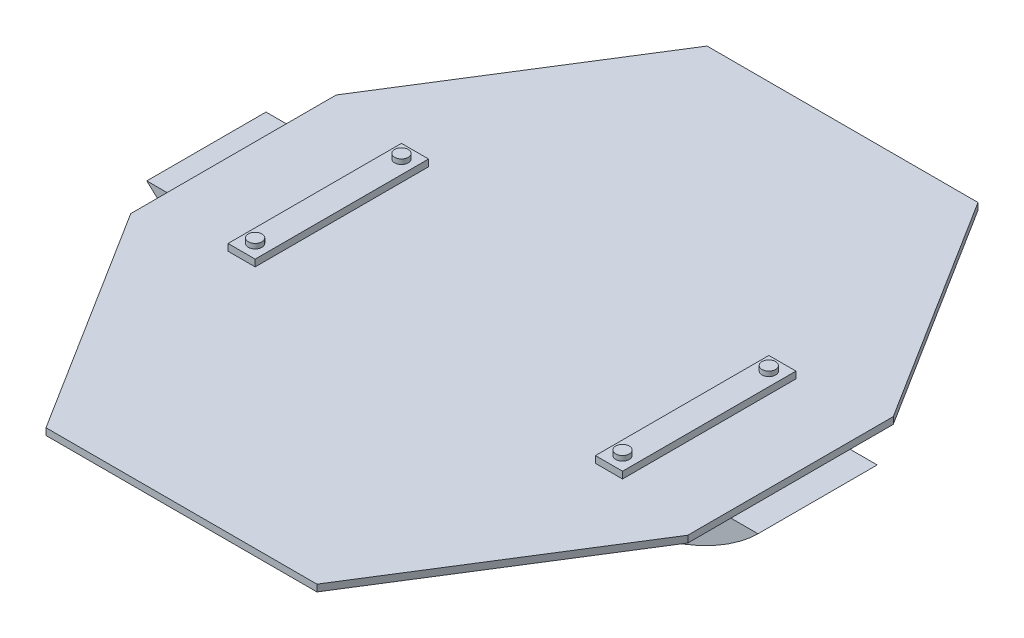
from build123d import *

# Parameters (mm, degrees)
BOSS_EXTRUDE1_DEPTH                 = 111.76
SKETCH5_W                           = 304.8
SKETCH5_H                           = 25.4
CUT_EXTRUDE3_DEPTH                  = 101.6
CUT_EXTRUDE4_DEPTH                  = 227.288199427
CUT_EXTRUDE4_DEPTH_BACK             = 227.288199427
SKETCH3_W                           = 96.52
SKETCH3_H                           = 101.6
SKETCH3_W_2                         = 48.26
CUT_EXTRUDE5_REACH                  = 288.663
SKETCH6_W                           = 38.1
SKETCH6_H                           = 50.8
SKETCH7_W                           = 81.28
SKETCH7_H                           = 50.8
BOSS_EXTRUDE2_DEPTH                 = 5.08
SKETCH9_W                           = 5.08
SKETCH9_H                           = 95.25
BOSS_EXTRUDE3_DEPTH                 = 10.16
SKETCH10_W                          = 5.08
SKETCH10_H                          = 95.206439839
BOSS_EXTRUDE4_DEPTH                 = 10.16
CUT_EXTRUDE7_REACH                  = 208.854
FILLET1_R                           = 50.8
BOSS_EXTRUDE5_REACH                 = 208.854
CUT_EXTRUDE8_REACH                  = 248.593
CUT_EXTRUDE8_END_RADIUS             = 126.32098656
CUT_EXTRUDE8_DIRECTION_2_REACH      = 248.593
CUT_EXTRUDE8_DIRECTION_2_END_RADIUS = 126.32098656
BOSS_EXTRUDE6_REACH                 = 248.593
CUT_EXTRUDE9_DEPTH                  = 241.3
CUT_EXTRUDE9_DEPTH_BACK             = 241.3
CUT_EXTRUDE10_REACH                 = 346.185
SKETCH16_W                          = 38.1
SKETCH16_H                          = 50.8
CUT_EXTRUDE10_DIRECTION_2_REACH     = 346.185
CUT_EXTRUDE11_START                 = -319.532
SKETCH17_W                          = 111.76
SKETCH17_H                          = 50.800000001
CUT_EXTRUDE11_DEPTH                 = 639.064
BOSS_EXTRUDE7_DEPTH                 = 254
BOSS_EXTRUDE7_DEPTH_BACK            = 365.76
SKETCH19_W                          = 573.01922816
SKETCH19_H                          = 6.35
CUT_EXTRUDE12_DEPTH                 = 6.35
CUT_EXTRUDE13_REACH                 = 470.643
SKETCH21_W                          = 25.392722083
SKETCH21_H                          = 6.35
CUT_EXTRUDE13_DIRECTION_2_REACH     = 470.643
SKETCH22_W                          = 25.4
SKETCH22_H                          = 6.35
BOSS_EXTRUDE8_DEPTH                 = 25.4
SKETCH23_W                          = 25.4
SKETCH23_H                          = 162.56
BOSS_EXTRUDE9_DEPTH                 = 12.7
BOSS_EXTRUDE10_DEPTH                = 5.08
BOSS_EXTRUDE10_DEPTH_BACK           = 63.5
SKETCH24_R                          = 6.393052053


with BuildPart() as part:
    # Sketch1 → Boss-Extrude1 (new body)
    with BuildSketch(Plane.XY):
        Polygon((-152.4, 62.23), (-152.4, -33.02), (0, -62.23), (152.4, -32.976439839), (152.4, 62.23), align=None)
    extrude(amount=-BOSS_EXTRUDE1_DEPTH)

    # Sketch5 → Cut-Extrude3 (cut)
    with BuildSketch(Plane.XY.offset(-5.08)):
        with Locations((0, -1.27)):
            Rectangle(SKETCH5_W, SKETCH5_H)
    extrude(amount=-CUT_EXTRUDE3_DEPTH, mode=Mode.SUBTRACT)

    # Sketch3 → Cut-Extrude4 (cut, two sides: drawn at the far end of the back side and taken through both)
    with BuildSketch(Plane(origin=(0, 62.23, 0), x_dir=(1, 0, 0), z_dir=(0, 1, 0)).offset(-CUT_EXTRUDE4_DEPTH_BACK)):
        with Locations((-50.8, 55.88)):
            Rectangle(SKETCH3_W, SKETCH3_H)
        with Locations((50.8, 55.88)):
            Rectangle(SKETCH3_W, SKETCH3_H)
        with Locations((-128.27, 55.88)):
            Rectangle(SKETCH3_W_2, SKETCH3_H)
        with Locations((128.27, 55.88)):
            Rectangle(SKETCH3_W_2, SKETCH3_H)
    extrude(amount=CUT_EXTRUDE4_DEPTH + CUT_EXTRUDE4_DEPTH_BACK, mode=Mode.SUBTRACT)

    # Cut-Extrude5: up to this face of the body (flat: up to its plane)
    cut_extrude5_end = Plane(part.part.faces().sort_by_distance((104.14, 36.83, -55.88))[0])
    # Sketch6 → Cut-Extrude5 (cut, up to the picked face)
    with BuildSketch(Plane.ZY.offset(104.14), mode=Mode.PRIVATE) as cut_extrude5_sk1:
        with Locations((-55.932057734, 36.83)):
            Rectangle(SKETCH6_W, SKETCH6_H)
    cut_extrude5_tool1 = split(extrude(cut_extrude5_sk1.sketch, amount=-CUT_EXTRUDE5_REACH, mode=Mode.PRIVATE), bisect_by=cut_extrude5_end, keep=Keep.BOTH, mode=Mode.PRIVATE)
    add(cut_extrude5_tool1.solids().sort_by(Axis((-104.14, 36.83, -55.932058), (1, 0, 0)))[0], mode=Mode.SUBTRACT)

    # Sketch7 → Boss-Extrude2 (add)
    with BuildSketch(Plane(origin=(0, 0, -36.882057734), x_dir=(-1, 0, 0), z_dir=(0, 0, -1))):
        with Locations((0, 36.83)):
            Rectangle(SKETCH7_W, SKETCH7_H)
        with Locations((101.6, 36.83)):
            Rectangle(SKETCH7_W, SKETCH7_H)
        with Locations((-101.6, 36.83)):
            Rectangle(SKETCH7_W, SKETCH7_H)
    boss_extrude2 = extrude(amount=-BOSS_EXTRUDE2_DEPTH)

    # Mirror1: Boss-Extrude2 across plane
    add(boss_extrude2.mirror(Plane(origin=(0, 0, -55.932057734), x_dir=(1, 0, 0), z_dir=(0, 0, -1))))

    # Sketch9 → Boss-Extrude3 (add)
    with BuildSketch(Plane.ZY.offset(152.4)):
        with Locations((-109.22, 14.605)):
            Rectangle(SKETCH9_W, SKETCH9_H)
        with Locations((-2.54, 14.605)):
            Rectangle(SKETCH9_W, SKETCH9_H)
    extrude(amount=BOSS_EXTRUDE3_DEPTH)

    # Sketch10 → Boss-Extrude4 (add)
    with BuildSketch(Plane(origin=(152.4, 0, 0), x_dir=(0, 0, -1), z_dir=(1, 0, 0))):
        with Locations((2.54, 14.626780081)):
            Rectangle(SKETCH10_W, SKETCH10_H)
        with Locations((109.22, 14.626780081)):
            Rectangle(SKETCH10_W, SKETCH10_H)
    extrude(amount=BOSS_EXTRUDE4_DEPTH)

    # Cut-Extrude7: up to this face of the body (flat: up to its plane)
    cut_extrude7_end = Plane(part.part.faces().sort_by_distance((-0.011490312, 7.400814094, -111.76))[0])
    # Sketch11 → Cut-Extrude7 (cut, up to the picked face)
    with BuildSketch(Plane.XY, mode=Mode.PRIVATE) as cut_extrude7_sk1:
        Polygon((-162.56, -12.7), (-119.696308585, -39.288207521), (-152.4, -33.02), (-162.56, -33.02), align=None)
    cut_extrude7_tool1 = split(extrude(cut_extrude7_sk1.sketch, amount=-CUT_EXTRUDE7_REACH, mode=Mode.PRIVATE), bisect_by=cut_extrude7_end, keep=Keep.BOTH, mode=Mode.PRIVATE)
    # Sketch11 → Cut-Extrude7 (cut, up to the picked face)
    with BuildSketch(Plane.XY, mode=Mode.PRIVATE) as cut_extrude7_sk2:
        Polygon((152.4, -33.02), (162.56, -33.02), (162.56, -12.7), (119.696308585, -39.288207521), align=None)
    cut_extrude7_tool2 = split(extrude(cut_extrude7_sk2.sketch, amount=-CUT_EXTRUDE7_REACH, mode=Mode.PRIVATE), bisect_by=cut_extrude7_end, keep=Keep.BOTH, mode=Mode.PRIVATE)
    add(cut_extrude7_tool1.solids().sort_by(Axis((-148.539263, -27.801749, 0), (0, 0, -1)))[0], mode=Mode.SUBTRACT)
    add(cut_extrude7_tool2.solids().sort_by(Axis((148.539263, -27.801749, 0), (0, 0, -1)))[0], mode=Mode.SUBTRACT)

    # Fillet1
    # the kernel refuses this fillet: 50.8 mm, written as the material it takes off along each edge
    with BuildSketch(Plane(origin=(-162.56, -12.7, 70.671047804), x_dir=(0.8497897447130388, -0.5271217978613181, 0), z_dir=(0, 0, -1)), Plane(origin=(-162.56, -12.7, -36.008952196), x_dir=(0.8497897447130388, -0.5271217978613181, 0), z_dir=(0, 0, -1)), Plane(origin=(162.56, -12.7, 70.671047804), x_dir=(0, 1, 0), z_dir=(0, 0, -1))) as fillet1_piece_1:
        with BuildLine():
            CenterArc((FILLET1_R * 0.556464943335, -FILLET1_R), FILLET1_R, 90, 58.188808221)
            Line((-FILLET1_R * 0.293324801378, -FILLET1_R * 0.472878202139), (0, 0))
            Line((0, 0), (FILLET1_R * 0.556464943335, 0))
        make_face()
    extrude(amount=146.422095607, mode=Mode.SUBTRACT)
    with BuildSketch(Plane(origin=(-119.696308585, -39.288207521, -83.186546401), x_dir=(0.9821230119270369, -0.18824024395268216, 0), z_dir=(0, 0, -1)), Plane(origin=(-119.696308585, -39.288207521, 23.493453599), x_dir=(0.9821230119270369, -0.18824024395268216, 0), z_dir=(0, 0, -1))) as fillet1_piece_2:
        with BuildLine():
            CenterArc((FILLET1_R * 0.184987823618, -FILLET1_R), FILLET1_R, 90, 20.961087149)
            Line((-FILLET1_R * 0.172745995297, -FILLET1_R * 0.0661764005955), (0, 0))
            Line((0, 0), (FILLET1_R * 0.184987823618, 0))
        make_face()
    extrude(amount=52.066907199, mode=Mode.SUBTRACT)
    with BuildSketch(Plane(origin=(162.56, -12.7, -36.008952196), x_dir=(-0.8497897447130388, -0.5271217978613181, 0), z_dir=(0, 0, -1))) as fillet1_piece_3:
        with BuildLine():
            CenterArc((FILLET1_R * 0.556464943335, FILLET1_R), FILLET1_R, 211.811191779, 58.188808221)
            Line((-FILLET1_R * 0.293324801378, FILLET1_R * 0.472878202139), (0, 0))
            Line((0, 0), (FILLET1_R * 0.556464943335, 0))
        make_face()
    extrude(amount=146.422095607, mode=Mode.SUBTRACT)
    with BuildSketch(Plane(origin=(119.776180176, -39.238663434, 23.475348992), x_dir=(-0.9820710795721669, -0.18851099349363817, 0), z_dir=(0, 0, -1)), Plane(origin=(119.776180176, -39.238663434, -83.204651008), x_dir=(-0.9820710795721669, -0.18851099349363817, 0), z_dir=(0, 0, -1))) as fillet1_piece_4:
        with BuildLine():
            CenterArc((FILLET1_R * 0.184845267653, FILLET1_R), FILLET1_R, 249.054708445, 20.945291555)
            Line((-FILLET1_R * 0.172631096402, FILLET1_R * 0.0660778141933), (0, 0))
            Line((0, 0), (FILLET1_R * 0.184845267653, 0))
        make_face()
    extrude(amount=52.030697984, mode=Mode.SUBTRACT)
    with BuildSketch(Plane(origin=(0, -62.23, 24.359816254), x_dir=(-0.982123011927037, 0.1882402439526816, 0), z_dir=(0, 0, -1))) as fillet1_piece_5:
        with BuildLine():
            CenterArc((FILLET1_R * 0.191809576801, FILLET1_R), FILLET1_R, 248.283995147, 21.716004853)
            Line((-FILLET1_R * 0.178196707507, FILLET1_R * 0.0709707488072), (0, 0))
            Line((0, 0), (FILLET1_R * 0.191809576801, 0))
        make_face()
    extrude(amount=160.479632508, mode=Mode.SUBTRACT)

    # Boss-Extrude5: up to this face of the body (flat: up to its plane)
    boss_extrude5_end = Plane(part.part.faces().sort_by_distance((-0.004732582, 8.379000895, -111.76))[0])
    # Sketch12 → Boss-Extrude5 (add, up to the picked face)
    with BuildSketch(Plane.XY, mode=Mode.PRIVATE) as boss_extrude5_sk1:
        with BuildLine():
            Line((-162.56, 62.23), (-210.82, 62.23))
            ThreePointArc((-210.82, 62.23), (-185.525923559, 8.586514121), (-138.537787331, -27.60089991))
            Line((-138.537787331, -27.60089991), (-162.56, 62.23))
        make_face()
    boss_extrude5_tool1 = split(extrude(boss_extrude5_sk1.sketch, amount=-BOSS_EXTRUDE5_REACH, mode=Mode.PRIVATE), bisect_by=boss_extrude5_end, keep=Keep.BOTH, mode=Mode.PRIVATE)
    # Sketch12 → Boss-Extrude5 (add, up to the picked face)
    with BuildSketch(Plane.XY, mode=Mode.PRIVATE) as boss_extrude5_sk2:
        with BuildLine():
            Line((162.56, 62.23), (210.82, 62.23))
            ThreePointArc((210.82, 62.23), (185.525923559, 8.586514121), (138.537787331, -27.60089991))
            Line((138.537787331, -27.60089991), (162.56, 62.23))
        make_face()
    boss_extrude5_tool2 = split(extrude(boss_extrude5_sk2.sketch, amount=-BOSS_EXTRUDE5_REACH, mode=Mode.PRIVATE), bisect_by=boss_extrude5_end, keep=Keep.BOTH, mode=Mode.PRIVATE)
    add(boss_extrude5_tool1.solids().sort_by(Axis((-173.436994, 26.131053, 0), (0, 0, -1)))[0])
    add(boss_extrude5_tool2.solids().sort_by(Axis((173.436994, 26.131053, 0), (0, 0, -1)))[0])

    # Cut-Extrude8: up to this cylinder (the profile starts inside it)
    cut_extrude8_end = Plane(origin=(-87.109319049, 87.777192878, -55.90231), z_dir=(0, 0, 1)) * Cylinder(CUT_EXTRUDE8_END_RADIUS, 750.827973119, mode=Mode.PRIVATE)
    # Sketch13 → Cut-Extrude8 (cut, up to the surface)
    with BuildSketch(Plane(origin=(0, 0, 0), x_dir=(0, 0, -1), z_dir=(1, 0, 0)), mode=Mode.PRIVATE) as cut_extrude8_sk1:
        Polygon((36.882057734, 62.23), (36.882057734, 11.43), (5.08, 11.43), (5.08, -13.97), (106.68, -13.97), (106.68, 11.43), (74.982057734, 11.43), (74.982057734, 62.23), align=None)
    cut_extrude8_tool1 = extrude(cut_extrude8_sk1.sketch, amount=-CUT_EXTRUDE8_REACH, mode=Mode.PRIVATE) & cut_extrude8_end
    add(cut_extrude8_tool1.solids().sort_by_distance((0, 15.058571, -55.90231))[0], mode=Mode.SUBTRACT)

    # Cut-Extrude8 direction 2: up to this cylinder (the profile starts inside it)
    cut_extrude8_direction_2_end = Plane(origin=(87.109319049, 87.777192878, -55.90231), z_dir=(0, 0, 1)) * Cylinder(CUT_EXTRUDE8_DIRECTION_2_END_RADIUS, 750.827973119, mode=Mode.PRIVATE)
    # Sketch13 → Cut-Extrude8 direction 2 (cut, up to the surface)
    with BuildSketch(Plane(origin=(0, 0, 0), x_dir=(0, 0, -1), z_dir=(1, 0, 0)), mode=Mode.PRIVATE) as cut_extrude8_direction_2_sk1:
        Polygon((36.882057734, 62.23), (36.882057734, 11.43), (5.08, 11.43), (5.08, -13.97), (106.68, -13.97), (106.68, 11.43), (74.982057734, 11.43), (74.982057734, 62.23), align=None)
    cut_extrude8_direction_2_tool1 = extrude(cut_extrude8_direction_2_sk1.sketch, amount=CUT_EXTRUDE8_DIRECTION_2_REACH, mode=Mode.PRIVATE) & cut_extrude8_direction_2_end
    add(cut_extrude8_direction_2_tool1.solids().sort_by_distance((0, 15.058571, -55.90231))[0], mode=Mode.SUBTRACT)

    # Boss-Extrude6: up to this face of the body (flat: up to its plane)
    boss_extrude6_end = Plane(part.part.faces().sort_by_distance((-0.004136206, 11.247831231, 0))[0])
    # Sketch14 → Boss-Extrude6 (add, up to the picked face)
    with BuildSketch(Plane(origin=(0, 0, -111.76), x_dir=(-1, 0, 0), z_dir=(0, 0, -1)), mode=Mode.PRIVATE) as boss_extrude6_sk1:
        with BuildLine():
            Line((-204.363754457, 62.23), (-319.532, 62.23))
            add(Edge.make_bspline(
                [(0.000127649, -61.30395141), (-63.035732171, -58.729844517), (-184.13294652, -59.341328161), (-298.396851531, 4.939109547), (-319.532, 62.23)],
                knots=[0, 0, 0, 0, 0.522454117, 1, 1, 1, 1], degree=3))
            Line((0.000127649, -61.30395141), (0.000127649, -56.388))
            add(Edge.make_bspline(
                [(0.000127649, -56.388), (-34.292089751, -49.634065585), (-117.293617019, -40.449633361), (-194.674150599, 7.604249577), (-204.363754457, 62.23)],
                knots=[0, 0, 0, 0, 0.415909415, 1, 1, 1, 1], degree=3))
        make_face()
    boss_extrude6_tool1 = split(extrude(boss_extrude6_sk1.sketch, amount=-BOSS_EXTRUDE6_REACH, mode=Mode.PRIVATE), bisect_by=boss_extrude6_end, keep=Keep.BOTH, mode=Mode.PRIVATE)
    # Sketch14 → Boss-Extrude6 (add, up to the picked face)
    with BuildSketch(Plane(origin=(0, 0, -111.76), x_dir=(-1, 0, 0), z_dir=(0, 0, -1)), mode=Mode.PRIVATE) as boss_extrude6_sk2:
        with BuildLine():
            Line((0.000127649, -56.388), (0.000127649, -61.30395141))
            add(Edge.make_bspline(
                [(0.000127649, -61.30395141), (63.035732171, -58.729844517), (184.13294652, -59.341328161), (298.396851531, 4.939109547), (319.532, 62.23)],
                knots=[0, 0, 0, 0, 0.522454117, 1, 1, 1, 1], degree=3))
            Line((319.532, 62.23), (204.363754457, 62.23))
            add(Edge.make_bspline(
                [(0.000127649, -56.388), (34.292089751, -49.634065585), (117.293617019, -40.449633361), (194.674150599, 7.604249577), (204.363754457, 62.23)],
                knots=[0, 0, 0, 0, 0.415909415, 1, 1, 1, 1], degree=3))
        make_face()
    boss_extrude6_tool2 = split(extrude(boss_extrude6_sk2.sketch, amount=-BOSS_EXTRUDE6_REACH, mode=Mode.PRIVATE), bisect_by=boss_extrude6_end, keep=Keep.BOTH, mode=Mode.PRIVATE)
    add(boss_extrude6_tool1.solids().sort_by(Axis((202.795825, 2.026931, -111.76), (0, 0, 1)))[0])
    add(boss_extrude6_tool2.solids().sort_by(Axis((-202.795984, 2.026638, -111.76), (0, 0, 1)))[0])

    # Sketch15 → Cut-Extrude9 (cut, two sides: drawn at the far end of the back side and taken through both)
    with BuildSketch(Plane(origin=(0, 0, 0), x_dir=(0, 0, -1), z_dir=(1, 0, 0)).offset(-CUT_EXTRUDE9_DEPTH_BACK)):
        Polygon((36.882057734, 62.23), (36.882057734, 11.43), (5.08, 11.43), (5.08, -13.97), (106.68, -13.97), (106.68, 11.43), (74.982057734, 11.43), (74.982057734, 62.23), align=None)
    extrude(amount=CUT_EXTRUDE9_DEPTH + CUT_EXTRUDE9_DEPTH_BACK, mode=Mode.SUBTRACT)

    # Sketch16 → Cut-Extrude10 (cut, up to next)
    with BuildSketch(Plane(origin=(0, 0, 0), x_dir=(0, 0, -1), z_dir=(1, 0, 0)), mode=Mode.PRIVATE) as cut_extrude10_sk1:
        with Locations((55.932057734, 36.83)):
            Rectangle(SKETCH16_W, SKETCH16_H)
    cut_extrude10_tool1 = extrude(cut_extrude10_sk1.sketch, amount=-CUT_EXTRUDE10_REACH, mode=Mode.PRIVATE) & part.part
    add(cut_extrude10_tool1.solids().sort_by_distance((0, 36.83, -55.932058))[0], mode=Mode.SUBTRACT)

    # Sketch16 → Cut-Extrude10 direction 2 (cut, up to next)
    with BuildSketch(Plane(origin=(0, 0, 0), x_dir=(0, 0, -1), z_dir=(1, 0, 0)), mode=Mode.PRIVATE) as cut_extrude10_direction_2_sk1:
        with Locations((55.932057734, 36.83)):
            Rectangle(SKETCH16_W, SKETCH16_H)
    cut_extrude10_direction_2_tool1 = extrude(cut_extrude10_direction_2_sk1.sketch, amount=CUT_EXTRUDE10_DIRECTION_2_REACH, mode=Mode.PRIVATE) & part.part
    add(cut_extrude10_direction_2_tool1.solids().sort_by_distance((0, 36.83, -55.932058))[0], mode=Mode.SUBTRACT)

    # Sketch17 → Cut-Extrude11 (cut)
    with BuildSketch(Plane(origin=(0, 0, 0), x_dir=(0, 0, -1), z_dir=(1, 0, 0)).offset(CUT_EXTRUDE11_START)):
        with Locations((55.88, 36.83)):
            Rectangle(SKETCH17_W, SKETCH17_H)
    extrude(amount=CUT_EXTRUDE11_DEPTH, mode=Mode.SUBTRACT)

    # Sketch19 → Boss-Extrude7 (add, two sides: drawn at the far end of the back side and taken through both)
    with BuildSketch(Plane.XY.offset(-BOSS_EXTRUDE7_DEPTH_BACK)):
        with Locations((0, 14.604999999)):
            Rectangle(SKETCH19_W, SKETCH19_H)
    extrude(amount=BOSS_EXTRUDE7_DEPTH + BOSS_EXTRUDE7_DEPTH_BACK)

    # Sketch20 → Cut-Extrude12 (cut)
    with BuildSketch(Plane.XZ.offset(-11.429999999)):
        Polygon((286.50961408, 0), (126.99761408, 254), (286.50961408, 254), align=None)
        Polygon((-126.99761408, 254), (-286.50961408, 0), (-286.50961408, 254), align=None)
        Polygon((-126.99761408, -365.76), (-286.50961408, -365.76), (-286.50961408, -111.76), align=None)
        Polygon((126.99761408, -365.76), (286.50961408, -365.76), (286.50961408, -111.76), align=None)
    extrude(amount=-CUT_EXTRUDE12_DEPTH, mode=Mode.SUBTRACT)

    # Sketch21 → Cut-Extrude13 (cut, up to next)
    with BuildSketch(Plane.XY, mode=Mode.PRIVATE) as cut_extrude13_sk1:
        with Locations((-273.813253039, 14.604999999)):
            Rectangle(SKETCH21_W, SKETCH21_H)
    cut_extrude13_tool1 = extrude(cut_extrude13_sk1.sketch, amount=-CUT_EXTRUDE13_REACH, mode=Mode.PRIVATE) & part.part
    # Sketch21 → Cut-Extrude13 (cut, up to next)
    with BuildSketch(Plane.XY, mode=Mode.PRIVATE) as cut_extrude13_sk2:
        with Locations((273.813253039, 14.604999999)):
            Rectangle(SKETCH21_W, SKETCH21_H)
    cut_extrude13_tool2 = extrude(cut_extrude13_sk2.sketch, amount=-CUT_EXTRUDE13_REACH, mode=Mode.PRIVATE) & part.part
    add(cut_extrude13_tool1.solids().sort_by_distance((-273.813253, 14.605, 0))[0], mode=Mode.SUBTRACT)
    add(cut_extrude13_tool2.solids().sort_by_distance((273.813253, 14.605, 0))[0], mode=Mode.SUBTRACT)

    # Sketch21 → Cut-Extrude13 direction 2 (cut, up to next)
    with BuildSketch(Plane.XY, mode=Mode.PRIVATE) as cut_extrude13_direction_2_sk1:
        with Locations((-273.813253039, 14.604999999)):
            Rectangle(SKETCH21_W, SKETCH21_H)
    cut_extrude13_direction_2_tool1 = extrude(cut_extrude13_direction_2_sk1.sketch, amount=CUT_EXTRUDE13_DIRECTION_2_REACH, mode=Mode.PRIVATE) & part.part
    # Sketch21 → Cut-Extrude13 direction 2 (cut, up to next)
    with BuildSketch(Plane.XY, mode=Mode.PRIVATE) as cut_extrude13_direction_2_sk2:
        with Locations((273.813253039, 14.604999999)):
            Rectangle(SKETCH21_W, SKETCH21_H)
    cut_extrude13_direction_2_tool2 = extrude(cut_extrude13_direction_2_sk2.sketch, amount=CUT_EXTRUDE13_DIRECTION_2_REACH, mode=Mode.PRIVATE) & part.part
    add(cut_extrude13_direction_2_tool1.solids().sort_by_distance((-273.813253, 14.605, 0))[0], mode=Mode.SUBTRACT)
    add(cut_extrude13_direction_2_tool2.solids().sort_by_distance((273.813253, 14.605, 0))[0], mode=Mode.SUBTRACT)

    # Sketch22 → Boss-Extrude8 (add)
    with BuildSketch(Plane.XY):
        with Locations((-172.20961408, -31.648409247)):
            Rectangle(SKETCH22_W, SKETCH22_H)
        with Locations((172.20961408, -31.648409247)):
            Rectangle(SKETCH22_W, SKETCH22_H)
    boss_extrude8 = extrude(amount=BOSS_EXTRUDE8_DEPTH)

    # Mirror2: Boss-Extrude8 across plane
    add(boss_extrude8.mirror(Plane(origin=(0, 0, -55.88), x_dir=(1, 0, 0), z_dir=(0, 0, -1))))

    # Sketch23 → Boss-Extrude9 (add)
    with BuildSketch(Plane.XZ.offset(-11.429999999)):
        with Locations((172.20961408, -55.88)):
            Rectangle(SKETCH23_W, SKETCH23_H)
        with Locations((-172.20961408, -55.88)):
            Rectangle(SKETCH23_W, SKETCH23_H)
    extrude(amount=-BOSS_EXTRUDE9_DEPTH)

    # Sketch24 → Boss-Extrude10 (add, two sides: drawn at the far end of the back side and taken through both)
    with BuildSketch(Plane.XZ.offset(34.823409247).offset(-BOSS_EXTRUDE10_DEPTH_BACK)):
        with Locations(Location((172.20961408, -124.46, 0), (0, 0, 270))):
            Circle(SKETCH24_R)
        with Locations(Location((172.20961408, 12.7, 0), (0, 0, 270))):
            Circle(SKETCH24_R)
        with Locations(Location((-172.237471997, 12.7, 0), (0, 0, 270))):
            Circle(SKETCH24_R)
        with Locations(Location((-172.237471997, -124.46, 0), (0, 0, 270))):
            Circle(SKETCH24_R)
    extrude(amount=BOSS_EXTRUDE10_DEPTH + BOSS_EXTRUDE10_DEPTH_BACK)


solid = part.part
